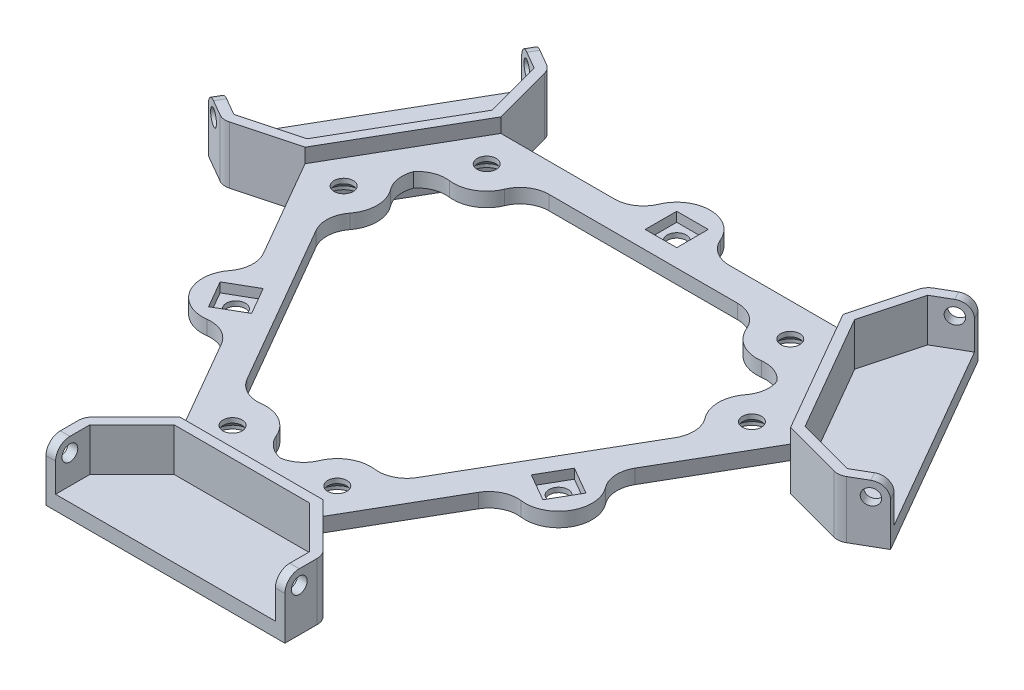
from build123d import *

# Parameters (mm, degrees)
BOSS_EXTRUDE1_DEPTH = 3
BOSS_EXTRUDE2_START = -6
BOSS_EXTRUDE2_DEPTH = 9
SKETCH3_R           = 1.65
CUT_EXTRUDE1_DEPTH  = 103.008982753
CIRPATTERN2_COUNT   = 3
SKETCH5_R           = 2
CUT_EXTRUDE3_DEPTH  = 99.774962346
FILLET2_R           = 3
SKETCH8_R           = 3.3
CUT_EXTRUDE6_DEPTH  = 2
CHAMFER2_SIZE       = 1.3
SKETCH9_R           = 7
BOSS_EXTRUDE3_DEPTH = 3
SKETCH10_W          = 6.6
SKETCH10_H          = 6.6
CUT_EXTRUDE7_DEPTH  = 2
SKETCH11_R          = 2
CUT_EXTRUDE8_DEPTH  = 99.774962346
FILLET1_R           = 6
FILLET3_R           = 3
BOSS_EXTRUDE4_START = 3
BOSS_EXTRUDE4_DEPTH = 3


# Some blends are built 0.0001 mm under size
with BuildPart() as part:
    # Sketch1 → Boss-Extrude1 (new body)
    with BuildSketch(Plane(origin=(0, 0, 0), x_dir=(1, 0, 0), z_dir=(0, 1, 0))):
        Polygon((50.801270189, 12.009618943), (35.801270189, 37.990381057), (-35.801270189, 37.990381057), (-50.801270189, 12.009618943), (-15, -50), (15, -50), align=None)
        with BuildLine():
            Line((-40.120290209, 18.509618943), (-36.089945324, 25.490381057))
            ThreePointArc((-36.089945324, 25.490381057), (-28.259818305, 24.92820323), (-24.831615075, 31.990381057))
            Line((-24.831615075, 31.990381057), (24.831615075, 31.990381057))
            ThreePointArc((24.831615075, 31.990381057), (28.259818305, 24.92820323), (36.089945324, 25.490381057))
            Line((36.089945324, 25.490381057), (40.120290209, 18.509618943))
            ThreePointArc((40.120290209, 18.509618943), (35.718366421, 12.009618943), (40.120290209, 5.509618943))
            Line((40.120290209, 5.509618943), (15.288675135, -37.5))
            ThreePointArc((15.288675135, -37.5), (7.458548116, -36.937822174), (4.030344885, -44))
            Line((4.030344885, -44), (-4.030344885, -44))
            ThreePointArc((-4.030344885, -44), (-7.458548116, -36.937822174), (-15.288675135, -37.5))
            Line((-15.288675135, -37.5), (-40.120290209, 5.509618943))
            ThreePointArc((-40.120290209, 5.509618943), (-35.718366421, 12.009618943), (-40.120290209, 18.509618943))
        make_face(mode=Mode.SUBTRACT)
    extrude(amount=BOSS_EXTRUDE1_DEPTH)

    # Sketch2 → Boss-Extrude2 (add)
    with BuildSketch(Plane.XZ.offset(BOSS_EXTRUDE2_START)):
        Polygon((25, 68), (25, 60), (15, 50), (-15, 50), (-25, 60), (-25, 68), (-23, 68), (-23, 60.828427125), (-14.171572875, 52), (14.171572875, 52), (23, 60.828427125), (23, 68), align=None)
    boss_extrude2 = extrude(amount=BOSS_EXTRUDE2_DEPTH)

    # Sketch3 → Cut-Extrude1 (cut, through all)
    with BuildSketch(Plane(origin=(25, 0, 0), x_dir=(0, 0, -1), z_dir=(1, 0, 0))):
        with Locations((-65, 3)):
            Circle(SKETCH3_R)
    cut_extrude1 = extrude(amount=-CUT_EXTRUDE1_DEPTH, mode=Mode.SUBTRACT)

    # CirPattern2: Boss-Extrude2, Cut-Extrude1 ×3 about axis
    cirpattern2_axis = Axis((0, 0, 0), (0, 1, 0))
    add([boss_extrude2.rotate(cirpattern2_axis, i * 360 / CIRPATTERN2_COUNT) for i in range(1, CIRPATTERN2_COUNT)])
    add([cut_extrude1.rotate(cirpattern2_axis, i * 360 / CIRPATTERN2_COUNT) for i in range(1, CIRPATTERN2_COUNT)], mode=Mode.SUBTRACT)

    # Sketch5 → Cut-Extrude3 (cut, through all)
    with BuildSketch(Plane(origin=(0, 3, 0), x_dir=(1, 0, 0), z_dir=(0, 1, 0))):
        with Locations(Location((42.718366421, 12.009618943, 0), (0, 0, 270))):
            Circle(SKETCH5_R)
        with Locations(Location((31.759818305, 30.990381057, 0), (0, 0, 270))):
            Circle(SKETCH5_R)
        with Locations(Location((10.958548116, -43, 0), (0, 0, 270))):
            Circle(SKETCH5_R)
        with Locations(Location((-10.958548116, -43, 0), (0, 0, 270))):
            Circle(SKETCH5_R)
        with Locations(Location((-42.718366421, 12.009618943, 0), (0, 0, 270))):
            Circle(SKETCH5_R)
        with Locations(Location((-31.759818305, 30.990381057, 0), (0, 0, 270))):
            Circle(SKETCH5_R)
    extrude(amount=-CUT_EXTRUDE3_DEPTH, mode=Mode.SUBTRACT)

    # Fillet2
    fillet2_edges = [part.edges().sort_by_distance(p)[0] for p in [
        (-39.461524227, 1.5, -51.650635095),
        (39.461524227, 1.5, -51.650635095),
        (64.461524227, 1.5, -8.349364905),
        (25, 1.5, 60),
        (-25, 1.5, 60),
        (-64.461524227, 1.5, -8.349364905),
    ]]
    fillet(fillet2_edges, radius=FILLET2_R)

    # Sketch8 → Cut-Extrude6 (cut)
    with BuildSketch(Plane.XZ):
        with Locations(Location((31.759818305, -30.990381057, 0), (0, 0, 270))):
            Circle(SKETCH8_R)
        with Locations(Location((42.718366421, -12.009618943, 0), (0, 0, 270))):
            Circle(SKETCH8_R)
        with Locations(Location((10.958548116, 43, 0), (0, 0, 270))):
            Circle(SKETCH8_R)
        with Locations(Location((-10.958548116, 43, 0), (0, 0, 270))):
            Circle(SKETCH8_R)
        with Locations(Location((-42.718366421, -12.009618943, 0), (0, 0, 270))):
            Circle(SKETCH8_R)
        with Locations(Location((-31.759818305, -30.990381057, 0), (0, 0, 270))):
            Circle(SKETCH8_R)
    extrude(amount=-CUT_EXTRUDE6_DEPTH, mode=Mode.SUBTRACT)

    # Chamfer2
    chamfer2_edges = [part.edges().sort_by_distance(p)[0] for p in [
        (31.759818305, 2, -27.690381057),
        (42.718366421, 2, -8.709618943),
        (10.958548116, 2, 46.3),
        (-10.958548116, 2, 46.3),
        (-42.718366421, 2, -8.709618943),
        (-31.759818305, 2, -27.690381057),
    ]]
    chamfer(chamfer2_edges, length=CHAMFER2_SIZE - 0.0001)  # a hair under: the kernel refuses the full size

    # Sketch9 → Boss-Extrude3 (add)
    with BuildSketch(Plane.XZ):
        with Locations((-33.766660498, 19.495190528)):
            Circle(SKETCH9_R)
        with Locations((33.766660498, 19.495190528)):
            Circle(SKETCH9_R)
        with Locations((0, -38.990381057)):
            Circle(SKETCH9_R)
    extrude(amount=-BOSS_EXTRUDE3_DEPTH)

    # Sketch10 → Cut-Extrude7 (cut)
    with BuildSketch(Plane(origin=(0, 3, 0), x_dir=(1, 0, 0), z_dir=(0, 1, 0))):
        Polygon((32.558776666, -14.987306696), (29.258776666, -20.703074361), (34.974544331, -24.003074361), (38.274544331, -18.287306696), align=None)
        with Locations((0, 38.990381057)):
            Rectangle(SKETCH10_W, SKETCH10_H)
        Polygon((-29.258776666, -20.703074361), (-32.558776666, -14.987306696), (-38.274544331, -18.287306696), (-34.974544331, -24.003074361), align=None)
    extrude(amount=-CUT_EXTRUDE7_DEPTH, mode=Mode.SUBTRACT)

    # Sketch11 → Cut-Extrude8 (cut, through all)
    with BuildSketch(Plane(origin=(0, 3, 0), x_dir=(1, 0, 0), z_dir=(0, 1, 0))):
        with Locations(Location((-33.766660498, -19.495190528, 0), (0, 0, 270))):
            Circle(SKETCH11_R)
        with Locations(Location((33.766660498, -19.495190528, 0), (0, 0, 270))):
            Circle(SKETCH11_R)
        with Locations(Location((0, 38.990381057, 0), (0, 0, 270))):
            Circle(SKETCH11_R)
    extrude(amount=-CUT_EXTRUDE8_DEPTH, mode=Mode.SUBTRACT)

    # Fillet1
    # the kernel refuses this fillet: 6 mm, written as the material it adds along each edge
    with BuildSketch(Plane(origin=(-40.120290209, 0, -18.509618943), x_dir=(0.7964948080619212, 0, 0.6046453677407967), z_dir=(0, 1, 0)), Plane(origin=(36.089945324, 0, -25.490381057), x_dir=(-0.9218856527750745, 0, 0.38746205389363575), z_dir=(0, 1, 0)), Plane(origin=(-24.831615075, 0, -31.990381057), x_dir=(-0.12539084471315703, 0, 0.9921074216344322), z_dir=(0, 1, 0)), Plane(origin=(-36.36473671, 3, 12.995190528), x_dir=(-0.7964948080619212, 0, 0.6046453677407967), z_dir=(0, -1, 0))) as fillet1_piece_1:
        with BuildLine():
            CenterArc((5.316687649, 5.784112285), FILLET1_R, 187.203327123, 67.380135052)
            Line((-0.635956881, 5.031767216), (0, 0))
            ThreePointArc((0, 0), (1.860840677, 0.251869001), (3.721681354, 0))
        make_face()
    extrude(amount=3)
    with BuildSketch(Plane(origin=(-15.288675135, 0, 37.5), x_dir=(-0.5000000000000007, 0, -0.8660254037844382), z_dir=(0, 1, 0)), Plane(origin=(4.030344885, 0, 44), x_dir=(-1, 0, 0), z_dir=(0, 1, 0)), Plane(origin=(40.120290209, 0, -5.509618943), x_dir=(-0.4999999999999995, 0, 0.8660254037844389), z_dir=(0, 1, 0)), Plane(origin=(29.436533479, 3, 24.995190528), x_dir=(-0.4999999999999999, 0, 0.8660254037844387), z_dir=(0, -1, 0)), Plane(origin=(6.92820323, 3, -37.990381057), x_dir=(1, 0, 0), z_dir=(0, -1, 0))) as fillet1_piece_2:
        with BuildLine():
            CenterArc((5.07179677, -6), FILLET1_R, 90, 67.380135052)
            ThreePointArc((-0.466664769, -3.692307692), (0.016548721, -1.877735913), (0, 0))
            Line((0, 0), (5.07179677, 0))
        make_face()
    extrude(amount=3)
    with BuildSketch(Plane(origin=(-4.030344885, 0, 44), x_dir=(-0.12539084471315537, 0, -0.9921074216344323), z_dir=(0, 1, 0)), Plane(origin=(15.288675135, 0, 37.5), x_dir=(-0.921885652775076, 0, -0.3874620538936326), z_dir=(0, 1, 0)), Plane(origin=(40.120290209, 0, -18.509618943), x_dir=(-0.7964948080619191, 0, 0.6046453677407995), z_dir=(0, 1, 0)), Plane(origin=(36.36473671, 3, 12.995190528), x_dir=(0.7964948080619222, 0, 0.6046453677407955), z_dir=(0, -1, 0)), Plane(origin=(-6.92820323, 3, -37.990381057), x_dir=(0.1253908447131521, 0, -0.9921074216344328), z_dir=(0, -1, 0))) as fillet1_piece_3:
        with BuildLine():
            CenterArc((5.316687649, -5.784112285), FILLET1_R, 105.416537825, 67.380135052)
            Line((-0.635956881, -5.031767216), (0, 0))
            ThreePointArc((0, 0), (1.860840677, -0.251869001), (3.721681354, 0))
        make_face()
    extrude(amount=3)
    with BuildSketch(Plane(origin=(24.831615075, 0, -31.990381057), x_dir=(-1, 0, 0), z_dir=(0, 1, 0)), Plane(origin=(-36.089945324, 0, -25.490381057), x_dir=(-0.49999999999999967, 0, 0.8660254037844389), z_dir=(0, 1, 0)), Plane(origin=(-40.120290209, 0, -5.509618943), x_dir=(0.5000000000000014, 0, 0.8660254037844378), z_dir=(0, 1, 0)), Plane(origin=(-29.436533479, 3, 24.995190528), x_dir=(0.4999999999999993, 0, 0.866025403784439), z_dir=(0, -1, 0))) as fillet1_piece_4:
        with BuildLine():
            CenterArc((5.07179677, 6), FILLET1_R, 202.619864948, 67.380135052)
            ThreePointArc((-0.466664769, 3.692307692), (0.016548721, 1.877735913), (0, 0))
            Line((0, 0), (5.07179677, 0))
        make_face()
    extrude(amount=3)

    # Fillet3
    fillet3_edges = [part.edges().sort_by_distance(p)[0] for p in [
        (-70.889727457, 6, -13.215390309),
        (-46.889727457, 6, -54.784609691),
        (46.889727457, 6, -54.784609691),
        (70.889727457, 6, -13.215390309),
        (24, 6, 68),
        (-24, 6, 68),
    ]]
    fillet(fillet3_edges, radius=FILLET3_R)

    # Sketch12 → Boss-Extrude4 (add)
    with BuildSketch(Plane.XZ.offset(3).offset(BOSS_EXTRUDE4_START)):
        with BuildLine():
            Line((-23, 68), (23, 68))
            Line((23, 68), (25, 68))
            Line((25, 68), (25, 61.242640687))
            ThreePointArc((25, 61.242640687), (24.771638598, 60.09459039), (24.121320344, 59.121320344))
            Line((24.121320344, 59.121320344), (15, 50))
            Line((15, 50), (-15, 50))
            Line((-15, 50), (-24.121320344, 59.121320344))
            ThreePointArc((-24.121320344, 59.121320344), (-24.771638598, 60.09459039), (-25, 61.242640687))
            Line((-25, 61.242640687), (-25, 68))
            Line((-25, 68), (-23, 68))
        make_face()
        with BuildLine():
            Line((70.389727457, -14.081415713), (47.389727457, -53.918584287))
            Line((47.389727457, -53.918584287), (46.389727457, -55.650635095))
            Line((46.389727457, -55.650635095), (40.53768263, -52.271955438))
            ThreePointArc((40.53768263, -52.271955438), (39.657622609, -51.500163514), (39.139905151, -50.450336362))
            Line((39.139905151, -50.450336362), (35.801270189, -37.990381057))
            Line((35.801270189, -37.990381057), (50.801270189, -12.009618943))
            Line((50.801270189, -12.009618943), (63.261225495, -8.670983981))
            ThreePointArc((63.261225495, -8.670983981), (64.429261207, -8.594426876), (65.53768263, -8.970685249))
            Line((65.53768263, -8.970685249), (71.389727457, -12.349364905))
            Line((71.389727457, -12.349364905), (70.389727457, -14.081415713))
        make_face()
        with BuildLine():
            Line((-47.389727457, -53.918584287), (-70.389727457, -14.081415713))
            Line((-70.389727457, -14.081415713), (-71.389727457, -12.349364905))
            Line((-71.389727457, -12.349364905), (-65.53768263, -8.970685249))
            ThreePointArc((-65.53768263, -8.970685249), (-64.429261207, -8.594426876), (-63.261225495, -8.670983981))
            Line((-63.261225495, -8.670983981), (-50.801270189, -12.009618943))
            Line((-50.801270189, -12.009618943), (-35.801270189, -37.990381057))
            Line((-35.801270189, -37.990381057), (-39.139905151, -50.450336362))
            ThreePointArc((-39.139905151, -50.450336362), (-39.657622609, -51.500163514), (-40.53768263, -52.271955438))
            Line((-40.53768263, -52.271955438), (-46.389727457, -55.650635095))
            Line((-46.389727457, -55.650635095), (-47.389727457, -53.918584287))
        make_face()
    extrude(amount=-BOSS_EXTRUDE4_DEPTH)


solid = part.part
